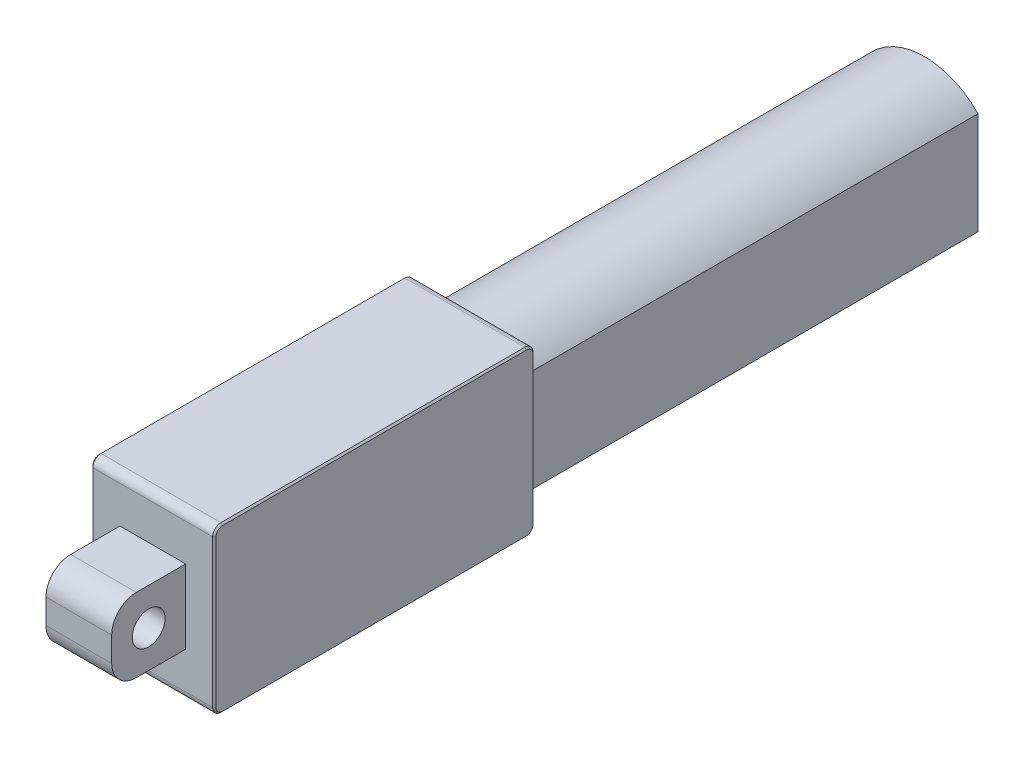
from build123d import *

# Parameters (mm, degrees)
SKETCH_1_R          = 2
EXTRUDE_1_DEPTH     = 8
EXTRUDE_2_DEPTH     = 39
EXTRUDE_3_DEPTH     = 55
SKETCH_4_R          = 4.5
CUT_EXTRUDE_1_DEPTH = 55
FILLET_1_R          = 1
CHAMFER_1_SIZE      = 0.2


with BuildPart() as part:
    # 草图1 → 凸台-拉伸1 (new body)
    with BuildSketch(Plane(origin=(0, 0, 0), x_dir=(0, 0, -1), z_dir=(1, 0, 0))):
        with BuildLine():
            Line((0, 4.5), (4.5, 4.5))
            Line((4.5, 4.5), (4.5, -4.5))
            Line((4.5, -4.5), (-1.5, -4.5))
            ThreePointArc((-1.5, -4.5), (-3.621320344, -3.621320344), (-4.5, -1.5))
            Line((-4.5, -1.5), (-4.5, 1.5))
            ThreePointArc((-4.5, 1.5), (-3.621320344, 3.621320344), (-1.5, 4.5))
            Line((-1.5, 4.5), (0, 4.5))
        make_face()
        Circle(SKETCH_1_R, mode=Mode.SUBTRACT)
    extrude(amount=EXTRUDE_1_DEPTH)

    # 草图2 → 凸台-拉伸2 (add)
    with BuildSketch(Plane(origin=(0, 0, -4.5), x_dir=(-1, 0, 0), z_dir=(0, 0, -1))):
        Polygon((-4, 10), (3.5, 10), (3.5, -10), (-11.5, -10), (-11.5, 10), align=None)
    extrude(amount=EXTRUDE_2_DEPTH)

    # 草图3 → 凸台-拉伸3 (add)
    with BuildSketch(Plane(origin=(0, 0, -43.5), x_dir=(-1, 0, 0), z_dir=(0, 0, -1))):
        with BuildLine():
            Line((2.5, 6.224949799), (2.5, -6.224949799))
            ThreePointArc((2.5, -6.224949799), (-4, -9), (-10.5, -6.224949799))
            Line((-10.5, -6.224949799), (-10.5, 6.224949799))
            ThreePointArc((-10.5, 6.224949799), (-4, 9), (2.5, 6.224949799))
        make_face()
    extrude(amount=EXTRUDE_3_DEPTH)

    # 草图4 → 切除-拉伸1 (cut)
    with BuildSketch(Plane(origin=(0, 0, -98.5), x_dir=(-1, 0, 0), z_dir=(0, 0, -1))):
        with Locations(Location((-4, 0, 0), (0, 0, 90))):
            Circle(SKETCH_4_R)
    extrude(amount=-CUT_EXTRUDE_1_DEPTH, mode=Mode.SUBTRACT)

    # 圆角1
    fillet_1_edges = [part.edges().sort_by_distance(p)[0] for p in [
        (4, -10, -4.5),
        (4, 10, -4.5),
        (4, 10, -43.5),
        (4, -10, -43.5),
    ]]
    fillet(fillet_1_edges, radius=FILLET_1_R - 0.0001)  # a hair under: the kernel refuses the full size

    # 倒角1
    chamfer_1_edges = [part.edges().sort_by_distance(p)[0] for p in [
        (-3.5, -10, -24),
        (11.5, -10, -24),
        (-3.5, 0, -4.5),
        (-3.5, 10, -24),
        (-3.5, 0, -43.5),
        (-3.5, 9.707136071, -4.792863929),
        (-3.5, 9.707136071, -43.207136071),
        (-3.5, -9.707136071, -43.207136071),
        (-3.5, -9.707136071, -4.792863929),
        (11.5, 0, -4.5),
        (11.5, 0, -43.5),
        (11.5, 10, -24),
        (11.5, 9.707136071, -4.792863929),
        (11.5, 9.707136071, -43.207136071),
        (11.5, -9.707136071, -43.207136071),
        (11.5, -9.707136071, -4.792863929),
    ]]
    chamfer(chamfer_1_edges, length=CHAMFER_1_SIZE)


solid = part.part
